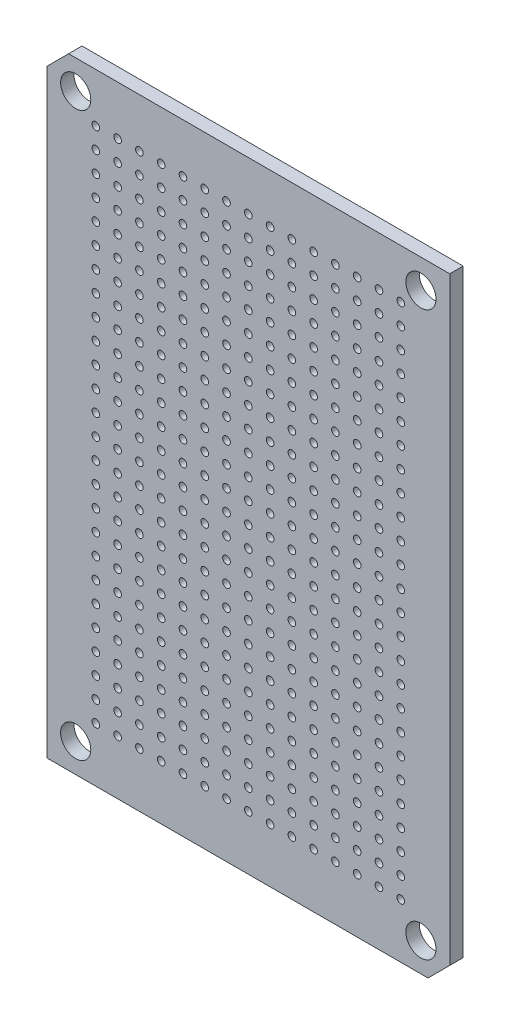
from build123d import *

# Parameters (mm, degrees)
SKETCH1_R           = 1.75895
BOSS_EXTRUDE1_DEPTH = 1.5621
SKETCH2_R           = 0.4445
CUT_EXTRUDE1_DEPTH  = 1.5621


with BuildPart() as part:
    # Sketch1 → Boss-Extrude1 (new body)
    with BuildSketch(Plane.XY):
        Polygon((0, 0), (44.45, 0), (46.99, 2.54), (46.99, 72.39), (2.54, 72.39), (0, 69.85), align=None)
        with Locations((3.3655, 69.0245)):
            Circle(SKETCH1_R, mode=Mode.SUBTRACT)
        with Locations((43.6245, 69.0245)):
            Circle(SKETCH1_R, mode=Mode.SUBTRACT)
        with Locations((43.6245, 3.3655)):
            Circle(SKETCH1_R, mode=Mode.SUBTRACT)
        with Locations((3.3655, 3.3655)):
            Circle(SKETCH1_R, mode=Mode.SUBTRACT)
    extrude(amount=BOSS_EXTRUDE1_DEPTH)

    # Sketch2 → Cut-Extrude1 (cut)
    with BuildSketch(Plane.XY.offset(1.5621)):
        with Locations((5.715, 66.675)):
            Circle(SKETCH2_R)
        with Locations((8.255, 66.675)):
            Circle(SKETCH2_R)
        with Locations((10.795, 66.675)):
            Circle(SKETCH2_R)
        with Locations((13.335, 66.675)):
            Circle(SKETCH2_R)
        with Locations((15.875, 66.675)):
            Circle(SKETCH2_R)
        with Locations((18.415, 66.675)):
            Circle(SKETCH2_R)
        with Locations((20.955, 66.675)):
            Circle(SKETCH2_R)
        with Locations((23.495, 66.675)):
            Circle(SKETCH2_R)
        with Locations((26.035, 66.675)):
            Circle(SKETCH2_R)
        with Locations((28.575, 66.675)):
            Circle(SKETCH2_R)
        with Locations((31.115, 66.675)):
            Circle(SKETCH2_R)
        with Locations((33.655, 66.675)):
            Circle(SKETCH2_R)
        with Locations((36.195, 66.675)):
            Circle(SKETCH2_R)
        with Locations((38.735, 66.675)):
            Circle(SKETCH2_R)
        with Locations((41.275, 66.675)):
            Circle(SKETCH2_R)
        with Locations((8.255, 64.262)):
            Circle(SKETCH2_R)
        with Locations((10.795, 64.262)):
            Circle(SKETCH2_R)
        with Locations((13.335, 64.262)):
            Circle(SKETCH2_R)
        with Locations((15.875, 64.262)):
            Circle(SKETCH2_R)
        with Locations((18.415, 64.262)):
            Circle(SKETCH2_R)
        with Locations((20.955, 64.262)):
            Circle(SKETCH2_R)
        with Locations((23.495, 64.262)):
            Circle(SKETCH2_R)
        with Locations((26.035, 64.262)):
            Circle(SKETCH2_R)
        with Locations((28.575, 64.262)):
            Circle(SKETCH2_R)
        with Locations((31.115, 64.262)):
            Circle(SKETCH2_R)
        with Locations((33.655, 64.262)):
            Circle(SKETCH2_R)
        with Locations((36.195, 64.262)):
            Circle(SKETCH2_R)
        with Locations((38.735, 64.262)):
            Circle(SKETCH2_R)
        with Locations((41.275, 64.262)):
            Circle(SKETCH2_R)
        with Locations((8.255, 61.849)):
            Circle(SKETCH2_R)
        with Locations((10.795, 61.849)):
            Circle(SKETCH2_R)
        with Locations((13.335, 61.849)):
            Circle(SKETCH2_R)
        with Locations((15.875, 61.849)):
            Circle(SKETCH2_R)
        with Locations((18.415, 61.849)):
            Circle(SKETCH2_R)
        with Locations((20.955, 61.849)):
            Circle(SKETCH2_R)
        with Locations((23.495, 61.849)):
            Circle(SKETCH2_R)
        with Locations((26.035, 61.849)):
            Circle(SKETCH2_R)
        with Locations((28.575, 61.849)):
            Circle(SKETCH2_R)
        with Locations((31.115, 61.849)):
            Circle(SKETCH2_R)
        with Locations((33.655, 61.849)):
            Circle(SKETCH2_R)
        with Locations((36.195, 61.849)):
            Circle(SKETCH2_R)
        with Locations((38.735, 61.849)):
            Circle(SKETCH2_R)
        with Locations((41.275, 61.849)):
            Circle(SKETCH2_R)
        with Locations((8.255, 59.436)):
            Circle(SKETCH2_R)
        with Locations((10.795, 59.436)):
            Circle(SKETCH2_R)
        with Locations((13.335, 59.436)):
            Circle(SKETCH2_R)
        with Locations((15.875, 59.436)):
            Circle(SKETCH2_R)
        with Locations((18.415, 59.436)):
            Circle(SKETCH2_R)
        with Locations((20.955, 59.436)):
            Circle(SKETCH2_R)
        with Locations((23.495, 59.436)):
            Circle(SKETCH2_R)
        with Locations((26.035, 59.436)):
            Circle(SKETCH2_R)
        with Locations((28.575, 59.436)):
            Circle(SKETCH2_R)
        with Locations((31.115, 59.436)):
            Circle(SKETCH2_R)
        with Locations((33.655, 59.436)):
            Circle(SKETCH2_R)
        with Locations((36.195, 59.436)):
            Circle(SKETCH2_R)
        with Locations((38.735, 59.436)):
            Circle(SKETCH2_R)
        with Locations((41.275, 59.436)):
            Circle(SKETCH2_R)
        with Locations((8.255, 57.023)):
            Circle(SKETCH2_R)
        with Locations((10.795, 57.023)):
            Circle(SKETCH2_R)
        with Locations((13.335, 57.023)):
            Circle(SKETCH2_R)
        with Locations((15.875, 57.023)):
            Circle(SKETCH2_R)
        with Locations((18.415, 57.023)):
            Circle(SKETCH2_R)
        with Locations((20.955, 57.023)):
            Circle(SKETCH2_R)
        with Locations((23.495, 57.023)):
            Circle(SKETCH2_R)
        with Locations((26.035, 57.023)):
            Circle(SKETCH2_R)
        with Locations((28.575, 57.023)):
            Circle(SKETCH2_R)
        with Locations((31.115, 57.023)):
            Circle(SKETCH2_R)
        with Locations((33.655, 57.023)):
            Circle(SKETCH2_R)
        with Locations((36.195, 57.023)):
            Circle(SKETCH2_R)
        with Locations((38.735, 57.023)):
            Circle(SKETCH2_R)
        with Locations((41.275, 57.023)):
            Circle(SKETCH2_R)
        with Locations((8.255, 54.61)):
            Circle(SKETCH2_R)
        with Locations((10.795, 54.61)):
            Circle(SKETCH2_R)
        with Locations((13.335, 54.61)):
            Circle(SKETCH2_R)
        with Locations((15.875, 54.61)):
            Circle(SKETCH2_R)
        with Locations((18.415, 54.61)):
            Circle(SKETCH2_R)
        with Locations((20.955, 54.61)):
            Circle(SKETCH2_R)
        with Locations((23.495, 54.61)):
            Circle(SKETCH2_R)
        with Locations((26.035, 54.61)):
            Circle(SKETCH2_R)
        with Locations((28.575, 54.61)):
            Circle(SKETCH2_R)
        with Locations((31.115, 54.61)):
            Circle(SKETCH2_R)
        with Locations((33.655, 54.61)):
            Circle(SKETCH2_R)
        with Locations((36.195, 54.61)):
            Circle(SKETCH2_R)
        with Locations((38.735, 54.61)):
            Circle(SKETCH2_R)
        with Locations((41.275, 54.61)):
            Circle(SKETCH2_R)
        with Locations((8.255, 52.197)):
            Circle(SKETCH2_R)
        with Locations((10.795, 52.197)):
            Circle(SKETCH2_R)
        with Locations((13.335, 52.197)):
            Circle(SKETCH2_R)
        with Locations((15.875, 52.197)):
            Circle(SKETCH2_R)
        with Locations((18.415, 52.197)):
            Circle(SKETCH2_R)
        with Locations((20.955, 52.197)):
            Circle(SKETCH2_R)
        with Locations((23.495, 52.197)):
            Circle(SKETCH2_R)
        with Locations((26.035, 52.197)):
            Circle(SKETCH2_R)
        with Locations((28.575, 52.197)):
            Circle(SKETCH2_R)
        with Locations((31.115, 52.197)):
            Circle(SKETCH2_R)
        with Locations((33.655, 52.197)):
            Circle(SKETCH2_R)
        with Locations((36.195, 52.197)):
            Circle(SKETCH2_R)
        with Locations((38.735, 52.197)):
            Circle(SKETCH2_R)
        with Locations((41.275, 52.197)):
            Circle(SKETCH2_R)
        with Locations((8.255, 49.784)):
            Circle(SKETCH2_R)
        with Locations((10.795, 49.784)):
            Circle(SKETCH2_R)
        with Locations((13.335, 49.784)):
            Circle(SKETCH2_R)
        with Locations((15.875, 49.784)):
            Circle(SKETCH2_R)
        with Locations((18.415, 49.784)):
            Circle(SKETCH2_R)
        with Locations((20.955, 49.784)):
            Circle(SKETCH2_R)
        with Locations((23.495, 49.784)):
            Circle(SKETCH2_R)
        with Locations((26.035, 49.784)):
            Circle(SKETCH2_R)
        with Locations((28.575, 49.784)):
            Circle(SKETCH2_R)
        with Locations((31.115, 49.784)):
            Circle(SKETCH2_R)
        with Locations((33.655, 49.784)):
            Circle(SKETCH2_R)
        with Locations((36.195, 49.784)):
            Circle(SKETCH2_R)
        with Locations((38.735, 49.784)):
            Circle(SKETCH2_R)
        with Locations((41.275, 49.784)):
            Circle(SKETCH2_R)
        with Locations((8.255, 47.371)):
            Circle(SKETCH2_R)
        with Locations((10.795, 47.371)):
            Circle(SKETCH2_R)
        with Locations((13.335, 47.371)):
            Circle(SKETCH2_R)
        with Locations((15.875, 47.371)):
            Circle(SKETCH2_R)
        with Locations((18.415, 47.371)):
            Circle(SKETCH2_R)
        with Locations((20.955, 47.371)):
            Circle(SKETCH2_R)
        with Locations((23.495, 47.371)):
            Circle(SKETCH2_R)
        with Locations((26.035, 47.371)):
            Circle(SKETCH2_R)
        with Locations((28.575, 47.371)):
            Circle(SKETCH2_R)
        with Locations((31.115, 47.371)):
            Circle(SKETCH2_R)
        with Locations((33.655, 47.371)):
            Circle(SKETCH2_R)
        with Locations((36.195, 47.371)):
            Circle(SKETCH2_R)
        with Locations((38.735, 47.371)):
            Circle(SKETCH2_R)
        with Locations((41.275, 47.371)):
            Circle(SKETCH2_R)
        with Locations((8.255, 44.958)):
            Circle(SKETCH2_R)
        with Locations((10.795, 44.958)):
            Circle(SKETCH2_R)
        with Locations((13.335, 44.958)):
            Circle(SKETCH2_R)
        with Locations((15.875, 44.958)):
            Circle(SKETCH2_R)
        with Locations((18.415, 44.958)):
            Circle(SKETCH2_R)
        with Locations((20.955, 44.958)):
            Circle(SKETCH2_R)
        with Locations((23.495, 44.958)):
            Circle(SKETCH2_R)
        with Locations((26.035, 44.958)):
            Circle(SKETCH2_R)
        with Locations((28.575, 44.958)):
            Circle(SKETCH2_R)
        with Locations((31.115, 44.958)):
            Circle(SKETCH2_R)
        with Locations((33.655, 44.958)):
            Circle(SKETCH2_R)
        with Locations((36.195, 44.958)):
            Circle(SKETCH2_R)
        with Locations((38.735, 44.958)):
            Circle(SKETCH2_R)
        with Locations((41.275, 44.958)):
            Circle(SKETCH2_R)
        with Locations((8.255, 42.545)):
            Circle(SKETCH2_R)
        with Locations((10.795, 42.545)):
            Circle(SKETCH2_R)
        with Locations((13.335, 42.545)):
            Circle(SKETCH2_R)
        with Locations((15.875, 42.545)):
            Circle(SKETCH2_R)
        with Locations((18.415, 42.545)):
            Circle(SKETCH2_R)
        with Locations((20.955, 42.545)):
            Circle(SKETCH2_R)
        with Locations((23.495, 42.545)):
            Circle(SKETCH2_R)
        with Locations((26.035, 42.545)):
            Circle(SKETCH2_R)
        with Locations((28.575, 42.545)):
            Circle(SKETCH2_R)
        with Locations((31.115, 42.545)):
            Circle(SKETCH2_R)
        with Locations((33.655, 42.545)):
            Circle(SKETCH2_R)
        with Locations((36.195, 42.545)):
            Circle(SKETCH2_R)
        with Locations((38.735, 42.545)):
            Circle(SKETCH2_R)
        with Locations((41.275, 42.545)):
            Circle(SKETCH2_R)
        with Locations((8.255, 40.132)):
            Circle(SKETCH2_R)
        with Locations((10.795, 40.132)):
            Circle(SKETCH2_R)
        with Locations((13.335, 40.132)):
            Circle(SKETCH2_R)
        with Locations((15.875, 40.132)):
            Circle(SKETCH2_R)
        with Locations((18.415, 40.132)):
            Circle(SKETCH2_R)
        with Locations((20.955, 40.132)):
            Circle(SKETCH2_R)
        with Locations((23.495, 40.132)):
            Circle(SKETCH2_R)
        with Locations((26.035, 40.132)):
            Circle(SKETCH2_R)
        with Locations((28.575, 40.132)):
            Circle(SKETCH2_R)
        with Locations((31.115, 40.132)):
            Circle(SKETCH2_R)
        with Locations((33.655, 40.132)):
            Circle(SKETCH2_R)
        with Locations((36.195, 40.132)):
            Circle(SKETCH2_R)
        with Locations((38.735, 40.132)):
            Circle(SKETCH2_R)
        with Locations((41.275, 40.132)):
            Circle(SKETCH2_R)
        with Locations((8.255, 37.719)):
            Circle(SKETCH2_R)
        with Locations((10.795, 37.719)):
            Circle(SKETCH2_R)
        with Locations((13.335, 37.719)):
            Circle(SKETCH2_R)
        with Locations((15.875, 37.719)):
            Circle(SKETCH2_R)
        with Locations((18.415, 37.719)):
            Circle(SKETCH2_R)
        with Locations((20.955, 37.719)):
            Circle(SKETCH2_R)
        with Locations((23.495, 37.719)):
            Circle(SKETCH2_R)
        with Locations((26.035, 37.719)):
            Circle(SKETCH2_R)
        with Locations((28.575, 37.719)):
            Circle(SKETCH2_R)
        with Locations((31.115, 37.719)):
            Circle(SKETCH2_R)
        with Locations((33.655, 37.719)):
            Circle(SKETCH2_R)
        with Locations((36.195, 37.719)):
            Circle(SKETCH2_R)
        with Locations((38.735, 37.719)):
            Circle(SKETCH2_R)
        with Locations((41.275, 37.719)):
            Circle(SKETCH2_R)
        with Locations((8.255, 35.306)):
            Circle(SKETCH2_R)
        with Locations((10.795, 35.306)):
            Circle(SKETCH2_R)
        with Locations((13.335, 35.306)):
            Circle(SKETCH2_R)
        with Locations((15.875, 35.306)):
            Circle(SKETCH2_R)
        with Locations((18.415, 35.306)):
            Circle(SKETCH2_R)
        with Locations((20.955, 35.306)):
            Circle(SKETCH2_R)
        with Locations((23.495, 35.306)):
            Circle(SKETCH2_R)
        with Locations((26.035, 35.306)):
            Circle(SKETCH2_R)
        with Locations((28.575, 35.306)):
            Circle(SKETCH2_R)
        with Locations((31.115, 35.306)):
            Circle(SKETCH2_R)
        with Locations((33.655, 35.306)):
            Circle(SKETCH2_R)
        with Locations((36.195, 35.306)):
            Circle(SKETCH2_R)
        with Locations((38.735, 35.306)):
            Circle(SKETCH2_R)
        with Locations((41.275, 35.306)):
            Circle(SKETCH2_R)
        with Locations((8.255, 32.893)):
            Circle(SKETCH2_R)
        with Locations((10.795, 32.893)):
            Circle(SKETCH2_R)
        with Locations((13.335, 32.893)):
            Circle(SKETCH2_R)
        with Locations((15.875, 32.893)):
            Circle(SKETCH2_R)
        with Locations((18.415, 32.893)):
            Circle(SKETCH2_R)
        with Locations((20.955, 32.893)):
            Circle(SKETCH2_R)
        with Locations((23.495, 32.893)):
            Circle(SKETCH2_R)
        with Locations((26.035, 32.893)):
            Circle(SKETCH2_R)
        with Locations((28.575, 32.893)):
            Circle(SKETCH2_R)
        with Locations((31.115, 32.893)):
            Circle(SKETCH2_R)
        with Locations((33.655, 32.893)):
            Circle(SKETCH2_R)
        with Locations((36.195, 32.893)):
            Circle(SKETCH2_R)
        with Locations((38.735, 32.893)):
            Circle(SKETCH2_R)
        with Locations((41.275, 32.893)):
            Circle(SKETCH2_R)
        with Locations((8.255, 30.48)):
            Circle(SKETCH2_R)
        with Locations((10.795, 30.48)):
            Circle(SKETCH2_R)
        with Locations((13.335, 30.48)):
            Circle(SKETCH2_R)
        with Locations((15.875, 30.48)):
            Circle(SKETCH2_R)
        with Locations((18.415, 30.48)):
            Circle(SKETCH2_R)
        with Locations((20.955, 30.48)):
            Circle(SKETCH2_R)
        with Locations((23.495, 30.48)):
            Circle(SKETCH2_R)
        with Locations((26.035, 30.48)):
            Circle(SKETCH2_R)
        with Locations((28.575, 30.48)):
            Circle(SKETCH2_R)
        with Locations((31.115, 30.48)):
            Circle(SKETCH2_R)
        with Locations((33.655, 30.48)):
            Circle(SKETCH2_R)
        with Locations((36.195, 30.48)):
            Circle(SKETCH2_R)
        with Locations((38.735, 30.48)):
            Circle(SKETCH2_R)
        with Locations((41.275, 30.48)):
            Circle(SKETCH2_R)
        with Locations((8.255, 28.067)):
            Circle(SKETCH2_R)
        with Locations((10.795, 28.067)):
            Circle(SKETCH2_R)
        with Locations((13.335, 28.067)):
            Circle(SKETCH2_R)
        with Locations((15.875, 28.067)):
            Circle(SKETCH2_R)
        with Locations((18.415, 28.067)):
            Circle(SKETCH2_R)
        with Locations((20.955, 28.067)):
            Circle(SKETCH2_R)
        with Locations((23.495, 28.067)):
            Circle(SKETCH2_R)
        with Locations((26.035, 28.067)):
            Circle(SKETCH2_R)
        with Locations((28.575, 28.067)):
            Circle(SKETCH2_R)
        with Locations((31.115, 28.067)):
            Circle(SKETCH2_R)
        with Locations((33.655, 28.067)):
            Circle(SKETCH2_R)
        with Locations((36.195, 28.067)):
            Circle(SKETCH2_R)
        with Locations((38.735, 28.067)):
            Circle(SKETCH2_R)
        with Locations((41.275, 28.067)):
            Circle(SKETCH2_R)
        with Locations((8.255, 25.654)):
            Circle(SKETCH2_R)
        with Locations((10.795, 25.654)):
            Circle(SKETCH2_R)
        with Locations((13.335, 25.654)):
            Circle(SKETCH2_R)
        with Locations((15.875, 25.654)):
            Circle(SKETCH2_R)
        with Locations((18.415, 25.654)):
            Circle(SKETCH2_R)
        with Locations((20.955, 25.654)):
            Circle(SKETCH2_R)
        with Locations((23.495, 25.654)):
            Circle(SKETCH2_R)
        with Locations((26.035, 25.654)):
            Circle(SKETCH2_R)
        with Locations((28.575, 25.654)):
            Circle(SKETCH2_R)
        with Locations((31.115, 25.654)):
            Circle(SKETCH2_R)
        with Locations((33.655, 25.654)):
            Circle(SKETCH2_R)
        with Locations((36.195, 25.654)):
            Circle(SKETCH2_R)
        with Locations((38.735, 25.654)):
            Circle(SKETCH2_R)
        with Locations((41.275, 25.654)):
            Circle(SKETCH2_R)
        with Locations((8.255, 23.241)):
            Circle(SKETCH2_R)
        with Locations((10.795, 23.241)):
            Circle(SKETCH2_R)
        with Locations((13.335, 23.241)):
            Circle(SKETCH2_R)
        with Locations((15.875, 23.241)):
            Circle(SKETCH2_R)
        with Locations((18.415, 23.241)):
            Circle(SKETCH2_R)
        with Locations((20.955, 23.241)):
            Circle(SKETCH2_R)
        with Locations((23.495, 23.241)):
            Circle(SKETCH2_R)
        with Locations((26.035, 23.241)):
            Circle(SKETCH2_R)
        with Locations((28.575, 23.241)):
            Circle(SKETCH2_R)
        with Locations((31.115, 23.241)):
            Circle(SKETCH2_R)
        with Locations((33.655, 23.241)):
            Circle(SKETCH2_R)
        with Locations((36.195, 23.241)):
            Circle(SKETCH2_R)
        with Locations((38.735, 23.241)):
            Circle(SKETCH2_R)
        with Locations((41.275, 23.241)):
            Circle(SKETCH2_R)
        with Locations((8.255, 20.828)):
            Circle(SKETCH2_R)
        with Locations((10.795, 20.828)):
            Circle(SKETCH2_R)
        with Locations((13.335, 20.828)):
            Circle(SKETCH2_R)
        with Locations((15.875, 20.828)):
            Circle(SKETCH2_R)
        with Locations((18.415, 20.828)):
            Circle(SKETCH2_R)
        with Locations((20.955, 20.828)):
            Circle(SKETCH2_R)
        with Locations((23.495, 20.828)):
            Circle(SKETCH2_R)
        with Locations((26.035, 20.828)):
            Circle(SKETCH2_R)
        with Locations((28.575, 20.828)):
            Circle(SKETCH2_R)
        with Locations((31.115, 20.828)):
            Circle(SKETCH2_R)
        with Locations((33.655, 20.828)):
            Circle(SKETCH2_R)
        with Locations((36.195, 20.828)):
            Circle(SKETCH2_R)
        with Locations((38.735, 20.828)):
            Circle(SKETCH2_R)
        with Locations((41.275, 20.828)):
            Circle(SKETCH2_R)
        with Locations((8.255, 18.415)):
            Circle(SKETCH2_R)
        with Locations((10.795, 18.415)):
            Circle(SKETCH2_R)
        with Locations((13.335, 18.415)):
            Circle(SKETCH2_R)
        with Locations((15.875, 18.415)):
            Circle(SKETCH2_R)
        with Locations((18.415, 18.415)):
            Circle(SKETCH2_R)
        with Locations((20.955, 18.415)):
            Circle(SKETCH2_R)
        with Locations((23.495, 18.415)):
            Circle(SKETCH2_R)
        with Locations((26.035, 18.415)):
            Circle(SKETCH2_R)
        with Locations((28.575, 18.415)):
            Circle(SKETCH2_R)
        with Locations((31.115, 18.415)):
            Circle(SKETCH2_R)
        with Locations((33.655, 18.415)):
            Circle(SKETCH2_R)
        with Locations((36.195, 18.415)):
            Circle(SKETCH2_R)
        with Locations((38.735, 18.415)):
            Circle(SKETCH2_R)
        with Locations((41.275, 18.415)):
            Circle(SKETCH2_R)
        with Locations((8.255, 16.002)):
            Circle(SKETCH2_R)
        with Locations((10.795, 16.002)):
            Circle(SKETCH2_R)
        with Locations((13.335, 16.002)):
            Circle(SKETCH2_R)
        with Locations((15.875, 16.002)):
            Circle(SKETCH2_R)
        with Locations((18.415, 16.002)):
            Circle(SKETCH2_R)
        with Locations((20.955, 16.002)):
            Circle(SKETCH2_R)
        with Locations((23.495, 16.002)):
            Circle(SKETCH2_R)
        with Locations((26.035, 16.002)):
            Circle(SKETCH2_R)
        with Locations((28.575, 16.002)):
            Circle(SKETCH2_R)
        with Locations((31.115, 16.002)):
            Circle(SKETCH2_R)
        with Locations((33.655, 16.002)):
            Circle(SKETCH2_R)
        with Locations((36.195, 16.002)):
            Circle(SKETCH2_R)
        with Locations((38.735, 16.002)):
            Circle(SKETCH2_R)
        with Locations((41.275, 16.002)):
            Circle(SKETCH2_R)
        with Locations((8.255, 13.589)):
            Circle(SKETCH2_R)
        with Locations((10.795, 13.589)):
            Circle(SKETCH2_R)
        with Locations((13.335, 13.589)):
            Circle(SKETCH2_R)
        with Locations((15.875, 13.589)):
            Circle(SKETCH2_R)
        with Locations((18.415, 13.589)):
            Circle(SKETCH2_R)
        with Locations((20.955, 13.589)):
            Circle(SKETCH2_R)
        with Locations((23.495, 13.589)):
            Circle(SKETCH2_R)
        with Locations((26.035, 13.589)):
            Circle(SKETCH2_R)
        with Locations((28.575, 13.589)):
            Circle(SKETCH2_R)
        with Locations((31.115, 13.589)):
            Circle(SKETCH2_R)
        with Locations((33.655, 13.589)):
            Circle(SKETCH2_R)
        with Locations((36.195, 13.589)):
            Circle(SKETCH2_R)
        with Locations((38.735, 13.589)):
            Circle(SKETCH2_R)
        with Locations((41.275, 13.589)):
            Circle(SKETCH2_R)
        with Locations((8.255, 11.176)):
            Circle(SKETCH2_R)
        with Locations((10.795, 11.176)):
            Circle(SKETCH2_R)
        with Locations((13.335, 11.176)):
            Circle(SKETCH2_R)
        with Locations((15.875, 11.176)):
            Circle(SKETCH2_R)
        with Locations((18.415, 11.176)):
            Circle(SKETCH2_R)
        with Locations((20.955, 11.176)):
            Circle(SKETCH2_R)
        with Locations((23.495, 11.176)):
            Circle(SKETCH2_R)
        with Locations((26.035, 11.176)):
            Circle(SKETCH2_R)
        with Locations((28.575, 11.176)):
            Circle(SKETCH2_R)
        with Locations((31.115, 11.176)):
            Circle(SKETCH2_R)
        with Locations((33.655, 11.176)):
            Circle(SKETCH2_R)
        with Locations((36.195, 11.176)):
            Circle(SKETCH2_R)
        with Locations((38.735, 11.176)):
            Circle(SKETCH2_R)
        with Locations((41.275, 11.176)):
            Circle(SKETCH2_R)
        with Locations((8.255, 8.763)):
            Circle(SKETCH2_R)
        with Locations((10.795, 8.763)):
            Circle(SKETCH2_R)
        with Locations((13.335, 8.763)):
            Circle(SKETCH2_R)
        with Locations((15.875, 8.763)):
            Circle(SKETCH2_R)
        with Locations((18.415, 8.763)):
            Circle(SKETCH2_R)
        with Locations((20.955, 8.763)):
            Circle(SKETCH2_R)
        with Locations((23.495, 8.763)):
            Circle(SKETCH2_R)
        with Locations((26.035, 8.763)):
            Circle(SKETCH2_R)
        with Locations((28.575, 8.763)):
            Circle(SKETCH2_R)
        with Locations((31.115, 8.763)):
            Circle(SKETCH2_R)
        with Locations((33.655, 8.763)):
            Circle(SKETCH2_R)
        with Locations((36.195, 8.763)):
            Circle(SKETCH2_R)
        with Locations((38.735, 8.763)):
            Circle(SKETCH2_R)
        with Locations((41.275, 8.763)):
            Circle(SKETCH2_R)
        with Locations((8.255, 6.35)):
            Circle(SKETCH2_R)
        with Locations((10.795, 6.35)):
            Circle(SKETCH2_R)
        with Locations((13.335, 6.35)):
            Circle(SKETCH2_R)
        with Locations((15.875, 6.35)):
            Circle(SKETCH2_R)
        with Locations((18.415, 6.35)):
            Circle(SKETCH2_R)
        with Locations((20.955, 6.35)):
            Circle(SKETCH2_R)
        with Locations((23.495, 6.35)):
            Circle(SKETCH2_R)
        with Locations((26.035, 6.35)):
            Circle(SKETCH2_R)
        with Locations((28.575, 6.35)):
            Circle(SKETCH2_R)
        with Locations((31.115, 6.35)):
            Circle(SKETCH2_R)
        with Locations((33.655, 6.35)):
            Circle(SKETCH2_R)
        with Locations((36.195, 6.35)):
            Circle(SKETCH2_R)
        with Locations((38.735, 6.35)):
            Circle(SKETCH2_R)
        with Locations((41.275, 6.35)):
            Circle(SKETCH2_R)
        with Locations((5.715, 64.262)):
            Circle(SKETCH2_R)
        with Locations((5.715, 61.849)):
            Circle(SKETCH2_R)
        with Locations((5.715, 59.436)):
            Circle(SKETCH2_R)
        with Locations((5.715, 57.023)):
            Circle(SKETCH2_R)
        with Locations((5.715, 54.61)):
            Circle(SKETCH2_R)
        with Locations((5.715, 52.197)):
            Circle(SKETCH2_R)
        with Locations((5.715, 49.784)):
            Circle(SKETCH2_R)
        with Locations((5.715, 47.371)):
            Circle(SKETCH2_R)
        with Locations((5.715, 44.958)):
            Circle(SKETCH2_R)
        with Locations((5.715, 42.545)):
            Circle(SKETCH2_R)
        with Locations((5.715, 40.132)):
            Circle(SKETCH2_R)
        with Locations((5.715, 37.719)):
            Circle(SKETCH2_R)
        with Locations((5.715, 35.306)):
            Circle(SKETCH2_R)
        with Locations((5.715, 32.893)):
            Circle(SKETCH2_R)
        with Locations((5.715, 30.48)):
            Circle(SKETCH2_R)
        with Locations((5.715, 28.067)):
            Circle(SKETCH2_R)
        with Locations((5.715, 25.654)):
            Circle(SKETCH2_R)
        with Locations((5.715, 23.241)):
            Circle(SKETCH2_R)
        with Locations((5.715, 20.828)):
            Circle(SKETCH2_R)
        with Locations((5.715, 18.415)):
            Circle(SKETCH2_R)
        with Locations((5.715, 16.002)):
            Circle(SKETCH2_R)
        with Locations((5.715, 13.589)):
            Circle(SKETCH2_R)
        with Locations((5.715, 11.176)):
            Circle(SKETCH2_R)
        with Locations((5.715, 8.763)):
            Circle(SKETCH2_R)
        with Locations((5.715, 6.35)):
            Circle(SKETCH2_R)
    extrude(amount=-CUT_EXTRUDE1_DEPTH, mode=Mode.SUBTRACT)


solid = part.part
